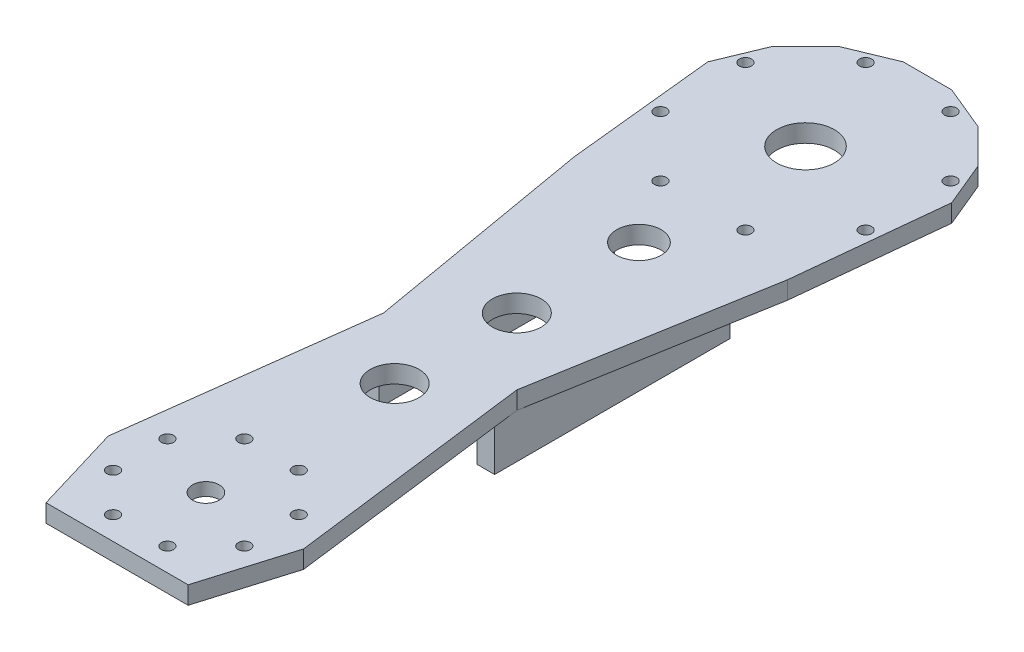
from build123d import *

# Parameters (mm, degrees)
SK_THIGH_PLATE_R         = 2.75
SK_THIGH_PLATE_R_2       = 6
SK_THIGH_PLATE_R_3       = 13
SK_THIGH_PLATE_R_4       = 11
SK_THIGH_PLATE_R_5       = 10
THIGH_PLATE_DEPTH        = 8
SK_PITCH_PILOT_RECESS_R  = 25.15
PITCH_PILOT_RECESS_DEPTH = 2.2
SK_FRONT_FLANGE_W        = 106
SK_FRONT_FLANGE_H        = 20
FRONT_FLANGE_DEPTH       = 8
SK_BACK_FLANGE_W         = 106
SK_BACK_FLANGE_H         = 20
BACK_FLANGE_DEPTH        = 8


with BuildPart() as part:
    # SK_Thigh_Plate → Thigh_Plate (new body)
    with BuildSketch(Plane(origin=(0, 36, 0), x_dir=(1, 0, 0), z_dir=(0, 1, 0))):
        Polygon((-32, -40), (32, -40), (44, 0), (30, 110), (48, 214), (54.923975703, 280.925058033), (46.562298289, 301.111933049), (31.111933049, 316.562298289), (10.925058033, 324.923975703), (-10.925058033, 324.923975703), (-31.111933049, 316.562298289), (-46.562298289, 301.111933049), (-54.923975703, 280.925058033), (-48, 214), (-30, 110), (-44, 0), align=None)
        with Locations((29.56414504, 12.245869836)):
            Circle(SK_THIGH_PLATE_R, mode=Mode.SUBTRACT)
        with Locations((12.245869836, 29.56414504)):
            Circle(SK_THIGH_PLATE_R, mode=Mode.SUBTRACT)
        with Locations((-12.245869836, 29.56414504)):
            Circle(SK_THIGH_PLATE_R, mode=Mode.SUBTRACT)
        with Locations((-29.56414504, 12.245869836)):
            Circle(SK_THIGH_PLATE_R, mode=Mode.SUBTRACT)
        with Locations((-29.56414504, -12.245869836)):
            Circle(SK_THIGH_PLATE_R, mode=Mode.SUBTRACT)
        with Locations((-12.245869836, -29.56414504)):
            Circle(SK_THIGH_PLATE_R, mode=Mode.SUBTRACT)
        with Locations((12.245869836, -29.56414504)):
            Circle(SK_THIGH_PLATE_R, mode=Mode.SUBTRACT)
        with Locations((29.56414504, -12.245869836)):
            Circle(SK_THIGH_PLATE_R, mode=Mode.SUBTRACT)
        with Locations((46.193976626, 289.134171618)):
            Circle(SK_THIGH_PLATE_R, mode=Mode.SUBTRACT)
        with Locations((19.134171618, 316.193976626)):
            Circle(SK_THIGH_PLATE_R, mode=Mode.SUBTRACT)
        with Locations((-19.134171618, 316.193976626)):
            Circle(SK_THIGH_PLATE_R, mode=Mode.SUBTRACT)
        with Locations((-46.193976626, 289.134171618)):
            Circle(SK_THIGH_PLATE_R, mode=Mode.SUBTRACT)
        with Locations((-46.193976626, 250.865828382)):
            Circle(SK_THIGH_PLATE_R, mode=Mode.SUBTRACT)
        with Locations((-19.134171618, 223.806023374)):
            Circle(SK_THIGH_PLATE_R, mode=Mode.SUBTRACT)
        with Locations((19.134171618, 223.806023374)):
            Circle(SK_THIGH_PLATE_R, mode=Mode.SUBTRACT)
        with Locations((46.193976626, 250.865828382)):
            Circle(SK_THIGH_PLATE_R, mode=Mode.SUBTRACT)
        Circle(SK_THIGH_PLATE_R_2, mode=Mode.SUBTRACT)
        with Locations((0, 270)):
            Circle(SK_THIGH_PLATE_R_3, mode=Mode.SUBTRACT)
        with Locations((0, 85)):
            Circle(SK_THIGH_PLATE_R_4, mode=Mode.SUBTRACT)
        with Locations((0, 140)):
            Circle(SK_THIGH_PLATE_R_4, mode=Mode.SUBTRACT)
        with Locations((0, 195)):
            Circle(SK_THIGH_PLATE_R_5, mode=Mode.SUBTRACT)
    extrude(amount=THIGH_PLATE_DEPTH)

    # SK_Pitch_Pilot_Recess → Pitch_Pilot_Recess (cut)
    with BuildSketch(Plane(origin=(0, 36, 0), x_dir=(1, 0, 0), z_dir=(0, 1, 0))):
        Circle(SK_PITCH_PILOT_RECESS_R)
    extrude(amount=PITCH_PILOT_RECESS_DEPTH, mode=Mode.SUBTRACT)

    # SK_Front_Flange → Front_Flange (add)
    with BuildSketch(Plane(origin=(22, 0, 0), x_dir=(0, 0, -1), z_dir=(1, 0, 0))):
        with Locations((153, 26)):
            Rectangle(SK_FRONT_FLANGE_W, SK_FRONT_FLANGE_H)
    extrude(amount=FRONT_FLANGE_DEPTH)

    # SK_Back_Flange → Back_Flange (add)
    with BuildSketch(Plane(origin=(-30, 0, 0), x_dir=(0, 0, -1), z_dir=(1, 0, 0))):
        with Locations((153, 26)):
            Rectangle(SK_BACK_FLANGE_W, SK_BACK_FLANGE_H)
    extrude(amount=BACK_FLANGE_DEPTH)


solid = part.part
